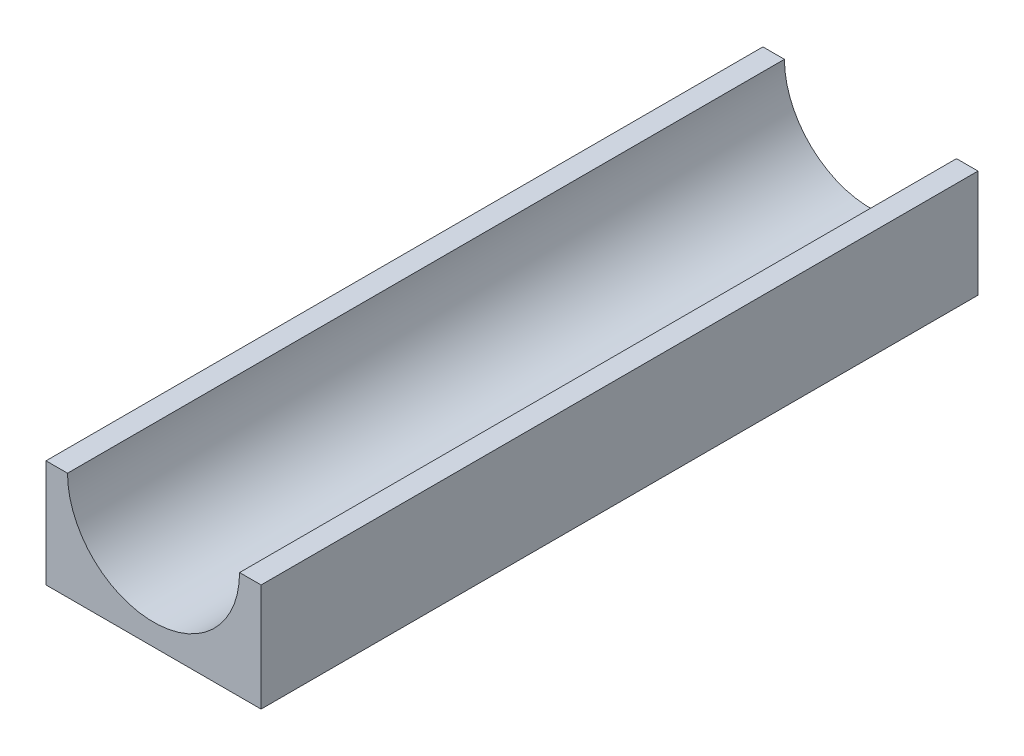
from build123d import *

# Parameters (mm, degrees)
BOSS_EXTRUDE1_DEPTH = 100


with BuildPart() as part:
    # Sketch2 → Boss-Extrude1 (new body)
    with BuildSketch(Plane.XY):
        with BuildLine():
            Line((0, 0), (-30, 0))
            Line((-30, 0), (-30, 15))
            Line((-30, 15), (-27, 15))
            ThreePointArc((-27, 15), (-15, 3), (-3, 15))
            Line((-3, 15), (0, 15))
            Line((0, 15), (0, 0))
        make_face()
    extrude(amount=BOSS_EXTRUDE1_DEPTH)


solid = part.part
